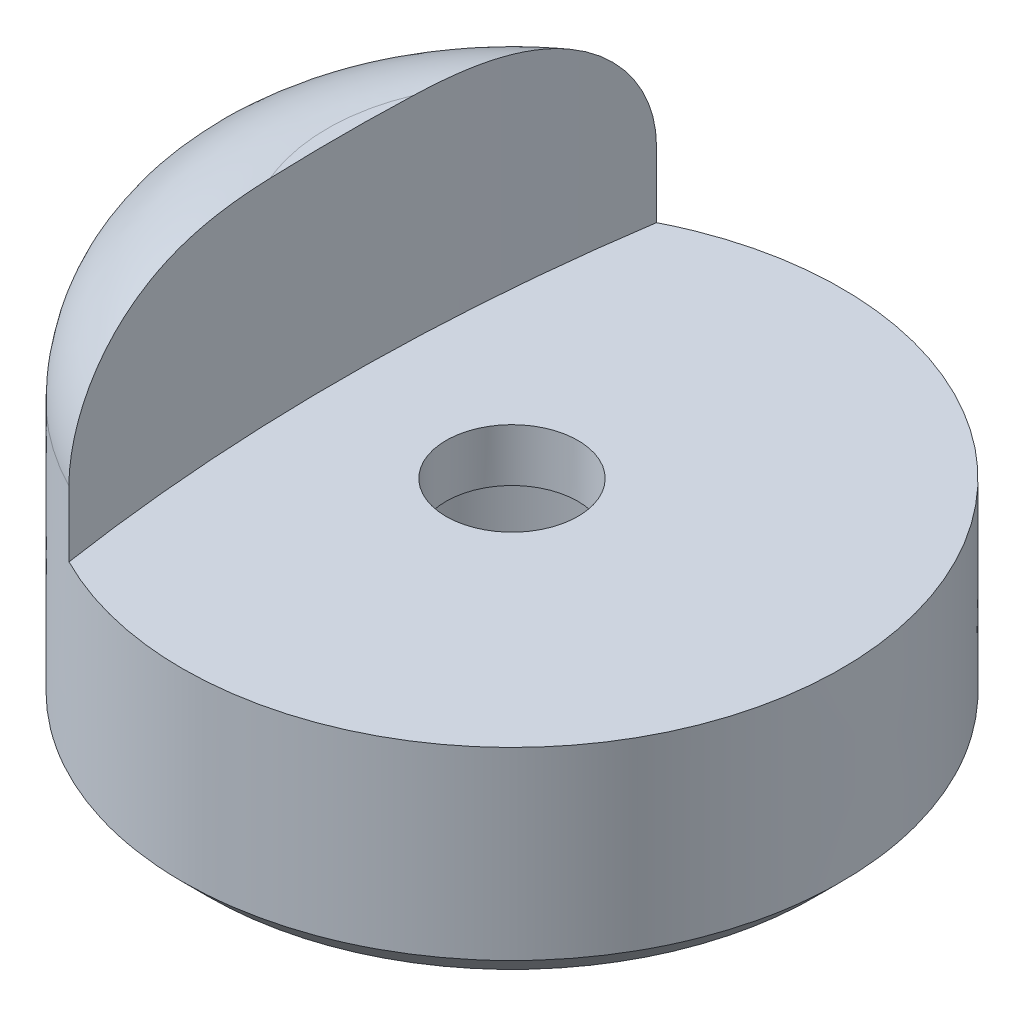
from build123d import *

# Parameters (mm, degrees)
BOSS_EXTRUDE1_DEPTH      = 10
BOSS_EXTRUDE1_DEPTH_BACK = 6
SKETCH1_RX               = 12.5
SKETCH1_RY               = 12.5
SKETCH1_R                = 2.5
CUT_EXTRUDE1_START       = -8
CUT_EXTRUDE1_OUTLINE_R   = 2.5
CUT_EXTRUDE1_DEPTH       = 8
FILLET1_R                = 5.5
SKETCH3_R                = 5.5
SKETCH3_R_2              = 2.5
CUT_EXTRUDE2_DEPTH       = 6
CHAMFER1_SIZE            = 1


# Read off the part's stored shape, not the designer's step: Cut-Extrude1
with BuildPart() as part:
    # Sketch1 → Boss-Extrude1 (new, two sides: drawn at the far end of the back side and taken through both)
    with BuildSketch(Plane(origin=(0, 0, 0), x_dir=(1, 0, 0), z_dir=(0, 1, 0)).offset(-BOSS_EXTRUDE1_DEPTH_BACK)):
        with Locations(Location((0, 0), (0, 0, -180))):
            Ellipse(SKETCH1_RX, SKETCH1_RY)
        with Locations(Location((0, 0, 0), (0, 0, 270))):
            Circle(SKETCH1_R, mode=Mode.SUBTRACT)
    extrude(amount=BOSS_EXTRUDE1_DEPTH + BOSS_EXTRUDE1_DEPTH_BACK)

    # Cut-Extrude1 outline → Cut-Extrude1 (cut)
    with BuildSketch(Plane(origin=(0, 10, 0), x_dir=(1, 0, 0), z_dir=(0, 1, 0)).offset(CUT_EXTRUDE1_START)):
        with BuildLine():
            add(Edge.make_bspline(
                [(-5.661764706, -11.144255041), (-4.512657491, -11.728051324), (-3.332619083, -12.141253277), (-2.167018805, -12.389388515), (-1.051861299, -12.5), (4.330127019, -12.5), (10.825317547, -10.416666667), (14.43375673, -4.166666667), (12.990381057, 2.5), (9.293805319, 8.902656992), (6.609319122, 11.644393421), (2.468408622, 13.548505079), (-2.218139666, 12.893765855), (-5.661764706, 11.144255041)],
                knots=[5.774421212, 5.774421212, 5.774421212, 5.774421212, 5.774421212, 5.774421212, 6.283185307, 6.283185307, 6.283185307, 6.283185307, 8.37758041, 8.37758041, 8.37758041, 8.37758041, 9.859103559, 9.859103559, 9.859103559, 9.859103559, 9.859103559, 9.859103559], degree=5, weights=[1, 1, 1.000149309, 1.000268817, 1, 1, 0.9, 0.9, 1, 1, 0.983486663, 0.969415241, 1, 1]))
            ThreePointArc((-5.661764706, 11.144255041), (-6.5, 0), (-5.661764706, -11.144255041))
        make_face()
        Circle(CUT_EXTRUDE1_OUTLINE_R, mode=Mode.SUBTRACT)
    extrude(amount=CUT_EXTRUDE1_DEPTH, mode=Mode.SUBTRACT)

    # Fillet1
    fillet1_edges = [part.edges().sort_by_distance(p)[0] for p in [
        (-10.6541555, 10, 6.537504921),
    ]]
    fillet(fillet1_edges, radius=FILLET1_R)

    # Sketch3 → Cut-Extrude2 (cut)
    with BuildSketch(Plane.XZ.offset(6)):
        with Locations(Location((0, 0, 0), (0, 0, 270))):
            Circle(SKETCH3_R)
        with Locations(Location((0, 0, 0), (0, 0, 90))):
            Circle(SKETCH3_R_2, mode=Mode.SUBTRACT)
    extrude(amount=-CUT_EXTRUDE2_DEPTH, mode=Mode.SUBTRACT)

    # Chamfer1
    chamfer1_edges = [part.edges().sort_by_distance(p)[0] for p in [
        (12.5, -6, 0),
    ]]
    chamfer(chamfer1_edges, length=CHAMFER1_SIZE)


solid = part.part
